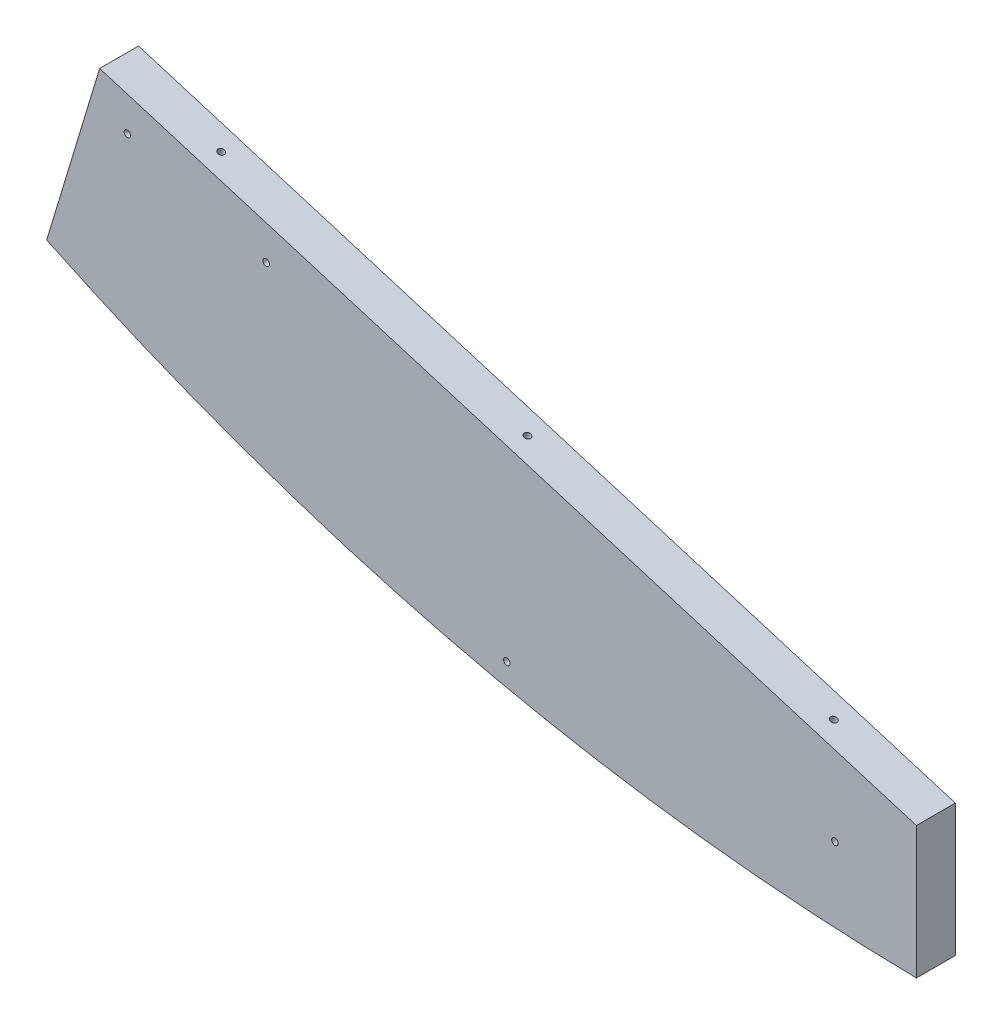
from build123d import *

# Parameters (mm, degrees)
BOSS_EXTRUDE1_DEPTH = 19.05
HOLE1_D             = 3.175
HOLE1_DEPTH         = 31.75
HOLE1_CSINK_D       = 10.16
HOLE1_CSINK_ANGLE   = 82
HOLE1_TIP           = 0.953866233
HOLE2_D             = 3.175
HOLE2_DEPTH         = 31.75
HOLE2_CSINK_D       = 10.16
HOLE2_CSINK_ANGLE   = 82
HOLE2_TIP           = 0.953866233
HOLE3_D             = 3.175
HOLE3_DEPTH         = 31.75
HOLE3_CSINK_D       = 10.16
HOLE3_CSINK_ANGLE   = 82
HOLE3_TIP           = 0.953866233
HOLE4_D             = 3.175
HOLE4_DEPTH         = 38.1
HOLE4_CSINK_D       = 10.16
HOLE4_CSINK_ANGLE   = 82
HOLE4_TIP           = 0.953866233
HOLE7_D             = 3.175
HOLE7_DEPTH         = 38.1
HOLE7_CSINK_D       = 10.16
HOLE7_CSINK_ANGLE   = 82
HOLE7_TIP           = 0.953866233


with BuildPart() as part:
    # Sketch1 → Boss-Extrude1 (new body)
    with BuildSketch(Plane.XY):
        with BuildLine():
            Line((-400.14087824, 384.351673867), (0, 263.246933614))
            Line((0, 263.246933614), (0, 198.540015411))
            ThreePointArc((0, 198.540015411), (-218.499895643, 225.348843149), (-426.096351675, 298.59247143))
            Line((-426.096351675, 298.59247143), (-400.14087824, 384.351673867))
        make_face()
    extrude(amount=-BOSS_EXTRUDE1_DEPTH)

    # Hole1
    with Locations(Plane(origin=(390.375064111, 158.3667868, -217.299999994), x_dir=(0, 0, -1), z_dir=(0.2896786029738461, 0.9571239768071433, 0))):
        with Locations((207.774999994, 613.051808534), (-207.774999994, 613.051808534), (-207.774999994, 456.277103296), (-207.774999994, 769.826513772), (-108.649999997, 456.277103296), (-108.649999997, 630.126513772), (-108.649999997, 769.826513772), (-207.774999994, 362.200879148), (-207.774999994, 305.10273792), (0, 305.10273792), (0, 362.200879148), (207.774999994, 305.10273792), (207.774999994, 362.200879148), (108.649999997, 769.826513772), (108.649999997, 630.126513772), (108.649999997, 456.277103296), (207.774999994, 769.826513772), (207.774999994, 456.277103296)):
            CounterSinkHole(HOLE1_D / 2, HOLE1_CSINK_D / 2, depth=HOLE1_DEPTH, counter_sink_angle=HOLE1_CSINK_ANGLE)
            with Locations((0, 0, -(HOLE1_DEPTH + HOLE1_TIP / 2))):  # 118° drill point
                Cone(0, HOLE1_D / 2, HOLE1_TIP, mode=Mode.SUBTRACT)

    # Hole2
    with Locations(Plane(origin=(277.286738577, -215.287141225, 12.7), x_dir=(-0.08995962873759034, 0.9959454127598536, 0), z_dir=(0, 0, 1))):
        with Locations((637.870011036, 553.595098153), (52.960474704, 241.752641108), (47.697836423, 183.489834462), (434.459074831, 134.806234549), (453.103621196, 177.188747915), (478.414399376, 275.292665941), (488.870508314, 435.756794718), (636.071223534, 609.111420407), (609.449424187, 543.22015483), (559.371199386, 359.303721429), (507.038658285, 229.776136946)):
            CounterSinkHole(HOLE2_D / 2, HOLE2_CSINK_D / 2, depth=HOLE2_DEPTH, counter_sink_angle=HOLE2_CSINK_ANGLE)
            with Locations((0, 0, -(HOLE2_DEPTH + HOLE2_TIP / 2))):  # 118° drill point
                Cone(0, HOLE2_D / 2, HOLE2_TIP, mode=Mode.SUBTRACT)

    # Hole3
    with Locations(Plane(origin=(277.286738577, -215.287141225, -31.75), x_dir=(0.08995962873759034, -0.9959454127598536, 0), z_dir=(0, 0, -1))):
        with Locations((-507.038658285, 229.776136946), (-559.371199386, 359.303721429), (-637.870011036, 553.595098153), (-636.071223534, 609.111420407), (-609.449424187, 543.22015483), (-488.870508314, 435.756794718), (-478.414399376, 275.292665941), (-453.103621196, 177.188747915), (-434.459074831, 134.806234549), (-52.960474704, 241.752641108), (-47.697836423, 183.489834462)):
            CounterSinkHole(HOLE3_D / 2, HOLE3_CSINK_D / 2, depth=HOLE3_DEPTH, counter_sink_angle=HOLE3_CSINK_ANGLE)
            with Locations((0, 0, -(HOLE3_DEPTH + HOLE3_TIP / 2))):  # 118° drill point
                Cone(0, HOLE3_D / 2, HOLE3_TIP, mode=Mode.SUBTRACT)

    # Hole4
    with Locations(Plane(origin=(-521.705760022, 26.532138606, -217.299999994), x_dir=(0, 0, 1), z_dir=(-0.9571239768071419, 0.2896786029738504, 0))):
        with Locations((-108.649999997, 332.89193461), (108.649999997, 332.89193461), (207.774999994, 332.89193461), (174.999999994, 448.336332751), (135.266666663, 384.042401694), (176.283333328, 384.042401694), (-174.999999994, 448.336332751), (-135.266666663, 384.042401694), (-176.283333328, 384.042401694), (-207.774999994, 332.89193461)):
            CounterSinkHole(HOLE4_D / 2, HOLE4_CSINK_D / 2, depth=HOLE4_DEPTH, counter_sink_angle=HOLE4_CSINK_ANGLE)
            with Locations((0, 0, -(HOLE4_DEPTH + HOLE4_TIP / 2))):  # 118° drill point
                Cone(0, HOLE4_D / 2, HOLE4_TIP, mode=Mode.SUBTRACT)

    # Hole7
    with Locations(Plane(origin=(-521.705760022, 26.532138606, 198.249999994), x_dir=(0, 0, 1), z_dir=(-0.9571239768071419, 0.2896786029738504, 0))):
        with Locations((-108.649999997, 332.89193461), (108.649999997, 332.89193461), (207.774999994, 332.89193461), (174.999999994, 448.336332751), (135.266666663, 384.042401694), (176.283333328, 384.042401694), (-174.999999994, 448.336332751), (-135.266666663, 384.042401694), (-176.283333328, 384.042401694), (-207.774999994, 332.89193461)):
            CounterSinkHole(HOLE7_D / 2, HOLE7_CSINK_D / 2, depth=HOLE7_DEPTH, counter_sink_angle=HOLE7_CSINK_ANGLE)
            with Locations((0, 0, -(HOLE7_DEPTH + HOLE7_TIP / 2))):  # 118° drill point
                Cone(0, HOLE7_D / 2, HOLE7_TIP, mode=Mode.SUBTRACT)


solid = part.part
